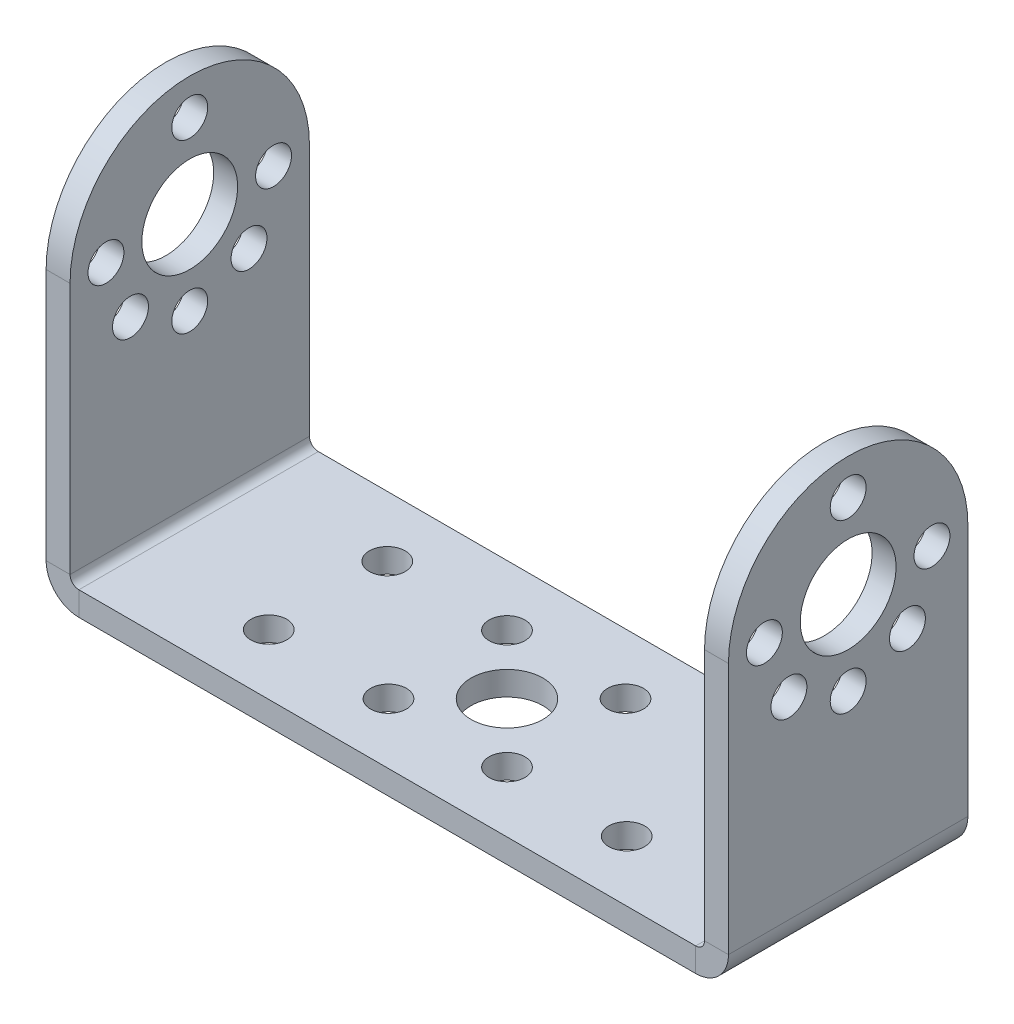
from build123d import *

# Parameters (mm, degrees)
SM_BASE_FLANGE_1_DEPTH = 20
EXTRUDE_1_DEPTH        = 2
EXTRUDE_START          = -2
EXTRUDE_2_DEPTH        = 2
SKETCH_8_R             = 4
SKETCH_8_R_2           = 1.5
CUT_EXTRUDE_1_DEPTH    = 65.618145883
SKETCH_9_R             = 3
SKETCH_9_R_2           = 1.5
CUT_EXTRUDE_2_DEPTH    = 2


# Sheet-metal steps are written as plain solids
with BuildPart() as part:
    # Sketch 1 → 基体-法兰1 (new body)
    with BuildSketch(Plane.XY):
        with BuildLine():
            Line((-12.079491004, 12.945691914), (-12.079491004, -8.117708086))
            ThreePointArc((-12.079491004, -8.117708086), (-11.863745859, -8.638562941), (-11.342891004, -8.854308086))
            Line((-11.342891004, -8.854308086), (40.183908996, -8.854308086))
            ThreePointArc((40.183908996, -8.854308086), (40.704763851, -8.638562941), (40.920508996, -8.117708086))
            Line((40.920508996, -8.117708086), (40.920508996, 12.945691914))
            Line((40.920508996, 12.945691914), (42.920508996, 12.945691914))
            Line((42.920508996, 12.945691914), (42.920508996, -8.117708086))
            ThreePointArc((42.920508996, -8.117708086), (42.118977413, -10.052776503), (40.183908996, -10.854308086))
            Line((40.183908996, -10.854308086), (-11.342891004, -10.854308086))
            ThreePointArc((-11.342891004, -10.854308086), (-13.277959422, -10.052776503), (-14.079491004, -8.117708086))
            Line((-14.079491004, -8.117708086), (-14.079491004, 12.945691914))
            Line((-14.079491004, 12.945691914), (-12.079491004, 12.945691914))
        make_face()
    extrude(amount=SM_BASE_FLANGE_1_DEPTH)

    # 草图6 → 凸台-拉伸1 (add)
    with BuildSketch(Plane.ZY.offset(14.079491004)):
        with BuildLine():
            Line((0, 12.945691914), (20, 12.945691914))
            ThreePointArc((20, 12.945691914), (10, 22.945691914), (0, 12.945691914))
        make_face()
    extrude(amount=-EXTRUDE_1_DEPTH)

    # 草图7 → 凸台-拉伸2 (add)
    with BuildSketch(Plane(origin=(42.920508996, 0, 0), x_dir=(0, 0, -1), z_dir=(1, 0, 0)).offset(EXTRUDE_START)):
        with BuildLine():
            Line((-20, 12.945691914), (0, 12.945691914))
            ThreePointArc((0, 12.945691914), (-10, 22.945691914), (-20, 12.945691914))
        make_face()
    extrude(amount=EXTRUDE_2_DEPTH)

    # 草图8 → 切除-拉伸1 (cut, through all)
    with BuildSketch(Plane.ZY.offset(14.079491004)):
        with Locations((10, 12.945691914)):
            Circle(SKETCH_8_R)
        with Locations((10, 19.945691914)):
            Circle(SKETCH_8_R_2)
        with Locations((17, 12.945691914)):
            Circle(SKETCH_8_R_2)
        with Locations((14.949747468, 7.995944446)):
            Circle(SKETCH_8_R_2)
        with Locations((10, 5.945691914)):
            Circle(SKETCH_8_R_2)
        with Locations((5.050252532, 7.995944446)):
            Circle(SKETCH_8_R_2)
        with Locations((3, 12.945691914)):
            Circle(SKETCH_8_R_2)
    extrude(amount=-CUT_EXTRUDE_1_DEPTH, mode=Mode.SUBTRACT)

    # 草图9 → 切除-拉伸2 (cut)
    with BuildSketch(Plane(origin=(0, -10.854308086, 0), x_dir=(-1, 0, 0), z_dir=(0, -1, 0))):
        with Locations(Location((-14.420508996, -10, 0), (0, 0, 90))):
            Circle(SKETCH_9_R)
        with Locations(Location((-29.370256464, -5.050252532, 0), (0, 0, 90))):
            Circle(SKETCH_9_R_2)
        with Locations(Location((-19.370256464, -5.050252532, 0), (0, 0, 90))):
            Circle(SKETCH_9_R_2)
        with Locations(Location((-9.470761527, -5.050252532, 0), (0, 0, 90))):
            Circle(SKETCH_9_R_2)
        with Locations(Location((-19.370256464, -14.949747468, 0), (0, 0, 90))):
            Circle(SKETCH_9_R_2)
        with Locations(Location((-9.470761527, -14.949747468, 0), (0, 0, 90))):
            Circle(SKETCH_9_R_2)
        with Locations(Location((-29.370256464, -14.949747468, 0), (0, 0, 90))):
            Circle(SKETCH_9_R_2)
        with Locations(Location((0.529238473, -5.050252532, 0), (0, 0, 90))):
            Circle(SKETCH_9_R_2)
        with Locations(Location((0.529238473, -14.949747468, 0), (0, 0, 90))):
            Circle(SKETCH_9_R_2)
    extrude(amount=-CUT_EXTRUDE_2_DEPTH, mode=Mode.SUBTRACT)


solid = part.part
